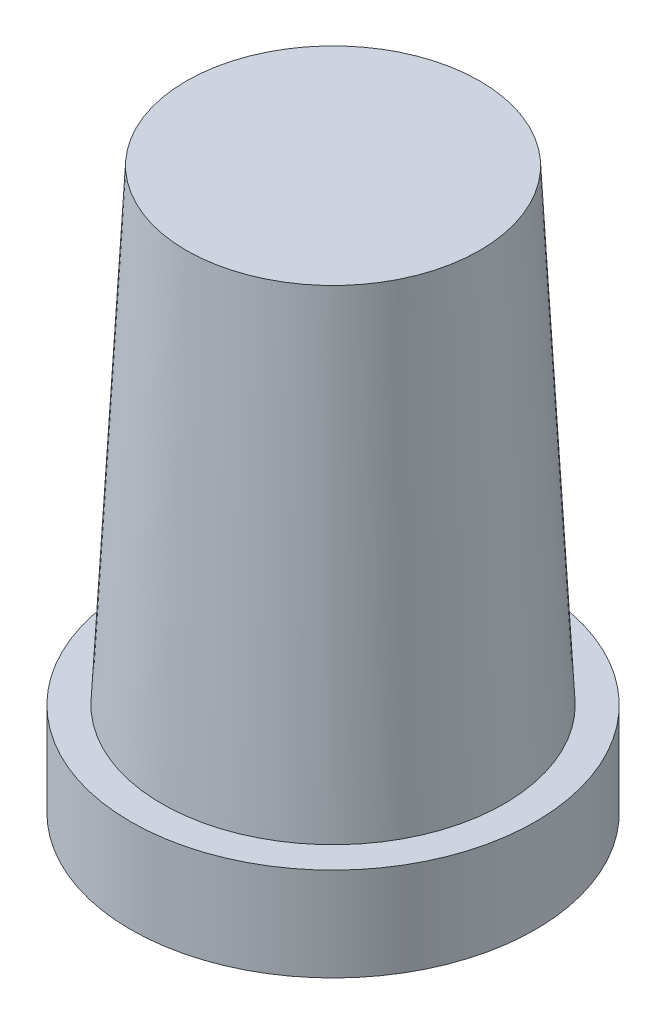
from build123d import *

# Parameters (mm, degrees)
SKETCH1_R           = 6.5
BOSS_EXTRUDE1_DEPTH = 18
SKETCH2_R           = 5
CUT_EXTRUDE1_DEPTH  = 4
CUT_EXTRUDE2_DEPTH  = 12
CHAMFER1_SIZE       = 1
CHAMFER1_SIZE2      = 0.577350269
SKETCH4_OUTSIDE_W   = 20.146
SKETCH4_OUTSIDE_H   = 20.146
SKETCH4_OUTSIDE_R   = 5.5
CUT_EXTRUDE3_DEPTH  = 15
CHAMFER2_SIZE       = 15
CHAMFER2_SIZE_2     = 0.786116689


with BuildPart() as part:
    # Sketch1 → Boss-Extrude1 (new body)
    with BuildSketch(Plane(origin=(0, 0, 0), x_dir=(1, 0, 0), z_dir=(0, 1, 0))):
        with Locations(Location((0, 0, 0), (0, 0, 270))):
            Circle(SKETCH1_R)
    extrude(amount=BOSS_EXTRUDE1_DEPTH)

    # Sketch2 → Cut-Extrude1 (cut)
    with BuildSketch(Plane.XZ):
        with Locations(Location((0, 0, 0), (0, 0, 270))):
            Circle(SKETCH2_R)
    extrude(amount=-CUT_EXTRUDE1_DEPTH, mode=Mode.SUBTRACT)

    # Sketch3 → Cut-Extrude2 (cut)
    with BuildSketch(Plane.XZ.offset(-4)):
        with BuildLine():
            Line((-1.732055507, -2.57098886), (3.04828024, -0.563903873))
            ThreePointArc((3.04828024, -0.563903873), (-1.200087257, 2.858284551), (-1.732055507, -2.57098886))
        make_face()
    extrude(amount=-CUT_EXTRUDE2_DEPTH, mode=Mode.SUBTRACT)

    # Chamfer1
    chamfer1_edges = [part.edges().sort_by_distance(p)[0] for p in [
        (0, 0, 5),
    ]]
    chamfer1_side = [part.faces().sort_by_distance(p)[0] for p in [
        (0, 2, 5),
    ]]
    chamfer(chamfer1_edges, length=CHAMFER1_SIZE, length2=CHAMFER1_SIZE2, reference=chamfer1_side[0])

    # Sketch4 outside → Cut-Extrude3 (cut)
    with BuildSketch(Plane(origin=(0, 18, 0), x_dir=(1, 0, 0), z_dir=(0, 1, 0))):
        Rectangle(SKETCH4_OUTSIDE_W, SKETCH4_OUTSIDE_H)
        with Locations(Location((0, 0, 0), (0, 0, 270))):
            Circle(SKETCH4_OUTSIDE_R, mode=Mode.SUBTRACT)
    extrude(amount=-CUT_EXTRUDE3_DEPTH, mode=Mode.SUBTRACT)

    # Chamfer2
    # the kernel refuses this chamfer: 15, 0.786116689 mm, written as the material it takes off along each edge
    with BuildSketch(Plane(origin=(0, 18, 0), x_dir=(0, 0, 1), z_dir=(-1, 0, 0))) as chamfer2_piece_1_section:
        Polygon((5.5, -CHAMFER2_SIZE), (5.5 - CHAMFER2_SIZE_2, 0), (5.5, 0), align=None)
    chamfer2_piece_1 = revolve(axis=Axis((0, 18, 0), (0, 1, 0)), mode=Mode.PRIVATE)
    chamfer2_piece_1 = split(chamfer2_piece_1, bisect_by=Plane(origin=(0, 3, -5.162730795), z_dir=(0, 1, 0)), keep=Keep.TOP, mode=Mode.PRIVATE)
    add(chamfer2_piece_1, mode=Mode.SUBTRACT)


solid = part.part
